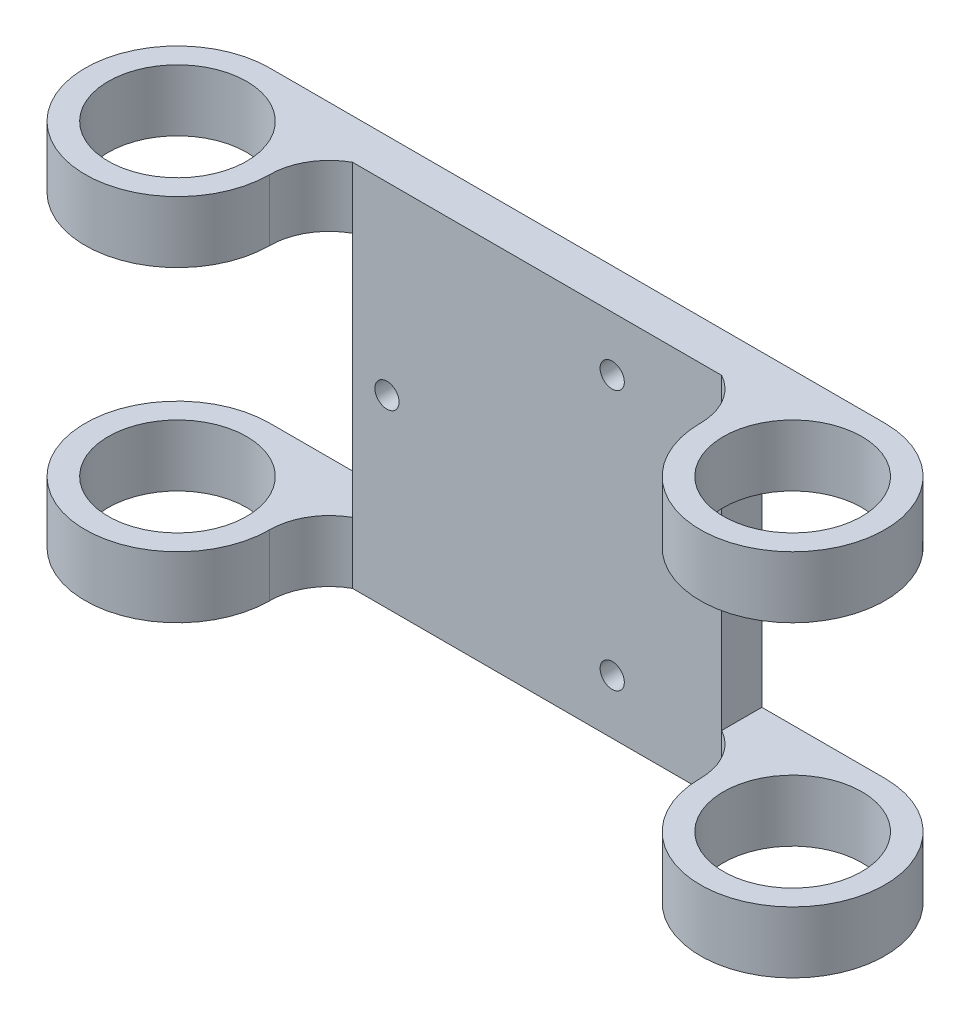
from build123d import *

# Parameters (mm, degrees)
SKETCH1_R               = 14.2875
BOSS_EXTRUDE1_DEPTH     = 76.2
CUT_EXTRUDE1_DEPTH      = 119.627789746
CUT_EXTRUDE1_DEPTH_BACK = 119.627789746
SKETCH2_W               = 129.990829903
SKETCH2_H               = 50.8
SKETCH2_W_2             = 94.099540571
SKETCH2_R               = 2.5


with BuildPart() as part:
    # Sketch1 → Boss-Extrude1 (new body)
    with BuildSketch(Plane(origin=(0, 0, 0), x_dir=(1, 0, 0), z_dir=(0, 1, 0))):
        with BuildLine():
            Line((63.5, 0), (-63.5, 0))
            ThreePointArc((-63.5, 0), (-76.970384182, -32.520384182), (-44.45, -19.05))
            ThreePointArc((-44.45, -19.05), (-42.743933719, -12.807304268), (-38.1, -8.3))
            Line((-38.1, -8.3), (38.1, -8.3))
            ThreePointArc((38.1, -8.3), (42.743933719, -12.807304268), (44.45, -19.05))
            ThreePointArc((44.45, -19.05), (76.970384182, -32.520384182), (63.5, 0))
        make_face()
        with Locations((-63.5, -19.05)):
            Circle(SKETCH1_R, mode=Mode.SUBTRACT)
        with Locations((63.5, -19.05)):
            Circle(SKETCH1_R, mode=Mode.SUBTRACT)
    extrude(amount=BOSS_EXTRUDE1_DEPTH)

    # Sketch2 → Cut-Extrude1 (cut, two sides: drawn at the far end of the back side and taken through both)
    with BuildSketch(Plane(origin=(0, 0, 0), x_dir=(-1, 0, 0), z_dir=(0, 0, -1)).offset(-CUT_EXTRUDE1_DEPTH_BACK)):
        with Locations((-103.095414952, 38.1)):
            Rectangle(SKETCH2_W, SKETCH2_H)
        with Locations((85.149770285, 38.1)):
            Rectangle(SKETCH2_W_2, SKETCH2_H)
        with Locations((-15.500122677, 64.947)):
            Circle(SKETCH2_R)
        with Locations((31.000245354, 38.1)):
            Circle(SKETCH2_R)
        with Locations((-15.500122677, 11.253)):
            Circle(SKETCH2_R)
    extrude(amount=CUT_EXTRUDE1_DEPTH + CUT_EXTRUDE1_DEPTH_BACK, mode=Mode.SUBTRACT)


solid = part.part
